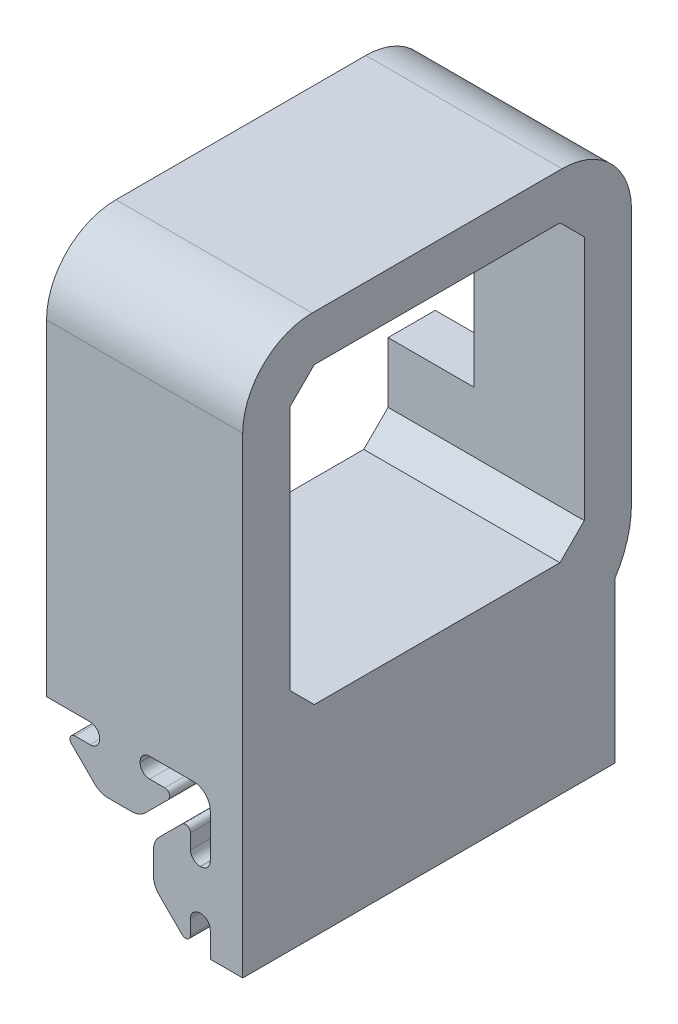
from build123d import *

# Parameters (mm, degrees)
BOSS_EXTRUDE1_DEPTH = 56
SKETCH14_W          = 42.4
SKETCH14_H          = 42.4
CUT_EXTRUDE1_DEPTH  = 56
CHAMFER1_SIZE       = 3.5
FILLET1_R           = 10
SKETCH16_W          = 2.4
SKETCH16_H          = 23
CUT_EXTRUDE3_DEPTH  = 95.009532523
CUT_EXTRUDE4_REACH  = 93.39
SKETCH17_W          = 15.453545708
SKETCH17_H          = 18
FILLET4_R           = 15
CUT_EXTRUDE5_DEPTH  = 92.389771857


with BuildPart() as part:
    # Sketch1 → Boss-Extrude1 (new body)
    with BuildSketch(Plane.XY):
        with BuildLine():
            Line((13.02, -7.9417418), (17.7, -7.9417418))
            Line((17.7, -7.9417418), (17.7, 70.02))
            Line((17.7, 70.02), (-10.566443095, 70.02))
            Line((-10.566443095, 70.02), (-10.566443095, 13.02))
            Line((-10.566443095, 13.02), (-5.317126718, 13.02))
            Line((-5.317126718, 13.02), (-4.287512407, 13.02))
            ThreePointArc((-4.287512407, 13.02), (-3.319474451, 12.619025549), (-2.9185, 11.650987593))
            Line((-2.9185, 11.650987593), (-2.9185, 11.539212407))
            ThreePointArc((-2.9185, 11.539212407), (-3.319474451, 10.571174451), (-4.287512407, 10.1702))
            Line((-4.287512407, 10.1702), (-6.476788598, 10.1702))
            ThreePointArc((-6.476788598, 10.1702), (-7.136510935, 9.729114651), (-6.981020848, 8.950903446))
            Line((-6.981020848, 8.950903446), (-3.672257405, 5.649701928))
            ThreePointArc((-3.672257405, 5.649701928), (-2.746830644, 5.032499411), (-1.655778399, 4.8158))
            Line((-1.655778399, 4.8158), (1.655778399, 4.8158))
            ThreePointArc((1.655778399, 4.8158), (2.746830644, 5.032499411), (3.672257405, 5.649701928))
            Line((3.672257405, 5.649701928), (6.981020848, 8.950903446))
            ThreePointArc((6.981020848, 8.950903446), (7.136510935, 9.729114651), (6.476788598, 10.1702))
            Line((6.476788598, 10.1702), (4.287512407, 10.1702))
            ThreePointArc((4.287512407, 10.1702), (3.319474451, 10.571174451), (2.9185, 11.539212407))
            Line((2.9185, 11.539212407), (2.9185, 11.650987593))
            ThreePointArc((2.9185, 11.650987593), (3.319474451, 12.619025549), (4.287512407, 13.02))
            Line((4.287512407, 13.02), (6.332886163, 13.02))
            Line((6.332886163, 13.02), (10.562594215, 13.019824354))
            ThreePointArc((10.562594215, 13.019824354), (12.303594776, 12.313982883), (13.019956614, 10.577284622))
            Line((13.019956614, 10.577284622), (13.02, 4.287469289))
            ThreePointArc((13.02, 4.287469289), (12.619025549, 3.319431332), (11.650987593, 2.918456882))
            Line((11.650987593, 2.918456882), (11.539212407, 2.918456882))
            ThreePointArc((11.539212407, 2.918456882), (10.571174451, 3.319431332), (10.1702, 4.287469289))
            Line((10.1702, 4.287469289), (10.1702, 6.402089023))
            ThreePointArc((10.1702, 6.402089023), (9.733877283, 7.055496588), (8.963146507, 6.90287605))
            Line((8.963146507, 6.90287605), (5.667020993, 3.614283579))
            ThreePointArc((5.667020993, 3.614283579), (5.046449321, 2.687255303), (4.8285, 1.593185507))
            Line((4.8285, 1.593185507), (4.8285, -1.593185507))
            ThreePointArc((4.8285, -1.593185507), (5.046449321, -2.687255303), (5.667020993, -3.614283579))
            Line((5.667020993, -3.614283579), (8.963146507, -6.90287605))
            ThreePointArc((8.963146507, -6.90287605), (9.733877283, -7.055496588), (10.1702, -6.402089023))
            Line((10.1702, -6.402089023), (10.1702, -4.287469289))
            ThreePointArc((10.1702, -4.287469289), (10.571174451, -3.319431332), (11.539212407, -2.918456882))
            Line((11.539212407, -2.918456882), (11.650987593, -2.918456882))
            ThreePointArc((11.650987593, -2.918456882), (12.619025549, -3.319431332), (13.02, -4.287469289))
            Line((13.02, -4.287469289), (13.02, -5.3170836))
            Line((13.02, -5.3170836), (13.02, -7.9417418))
        make_face()
    extrude(amount=BOSS_EXTRUDE1_DEPTH)

    # Sketch14 → Cut-Extrude1 (cut)
    with BuildSketch(Plane(origin=(17.7, 0, 0), x_dir=(0, 0, -1), z_dir=(1, 0, 0))):
        with Locations((-28, 42.22)):
            Rectangle(SKETCH14_W, SKETCH14_H)
    extrude(amount=-CUT_EXTRUDE1_DEPTH, mode=Mode.SUBTRACT)

    # Chamfer1
    chamfer1_edges = [part.edges().sort_by_distance(p)[0] for p in [
        (3.566778452, 21.02, 49.2),
        (3.566778452, 63.42, 49.2),
        (3.566778452, 63.42, 6.8),
        (3.566778452, 21.02, 6.8),
    ]]
    chamfer(chamfer1_edges, length=CHAMFER1_SIZE)

    # Fillet1
    fillet1_edges = [part.edges().sort_by_distance(p)[0] for p in [
        (3.566778452, 70.02, 56),
        (3.566778452, 70.02, 0),
    ]]
    fillet(fillet1_edges, radius=FILLET1_R)

    # Sketch16 → Cut-Extrude3 (cut, through all)
    with BuildSketch(Plane(origin=(17.7, 0, 0), x_dir=(0, 0, -1), z_dir=(1, 0, 0))):
        with Locations((-54.8, 3.5582582)):
            Rectangle(SKETCH16_W, SKETCH16_H)
    extrude(amount=-CUT_EXTRUDE3_DEPTH, mode=Mode.SUBTRACT)

    # Sketch17 → Cut-Extrude4 (cut, up to next)
    with BuildSketch(Plane.XY.offset(56), mode=Mode.PRIVATE) as cut_extrude4_sk1:
        with Locations((-5.893215949, 42.22)):
            Rectangle(SKETCH17_W, SKETCH17_H)
    cut_extrude4_tool1 = extrude(cut_extrude4_sk1.sketch, amount=-CUT_EXTRUDE4_REACH, mode=Mode.PRIVATE) & part.part
    add(cut_extrude4_tool1.solids().sort_by_distance((-5.893216, 42.22, 56))[0], mode=Mode.SUBTRACT)

    # Fillet4
    # the kernel refuses this fillet: 15 mm, written as the material it takes off along each edge
    with BuildSketch(Plane(origin=(38.046989949, 15.0582582, 56), x_dir=(0, 1, 0), z_dir=(-1, 0, 0))) as fillet4_piece_1:
        with BuildLine():
            CenterArc((8.13879598, 15), FILLET4_R, 237.140119621, 32.859880379)
            Line((0, 2.4), (-0.16277592, 2.148))
            ThreePointArc((-0.16277592, 2.148), (-0.3, 1.2), (-0.3, 0))
            Line((-0.3, 0), (0, -0.3))
            Line((0, -0.3), (8.13879598, -0.3))
            Line((8.13879598, -0.3), (8.13879598, 0))
        make_face()
    extrude(amount=68.960422994, mode=Mode.SUBTRACT)


with BuildPart() as body_2:
    # Mirror2: mirrored copy
    add(part.part.mirror(Plane(origin=(-4.287512407, 11.650987593, 0), x_dir=(1, 0, 0), z_dir=(0, 0, 1))))


with BuildPart() as part_1:
    add(part.part)

    # Sketch18 → Cut-Extrude5 (cut, through all)
    with BuildSketch(Plane(origin=(0, 0, 0), x_dir=(-1, 0, 0), z_dir=(0, 0, -1))):
        Polygon((-23.608513824, 16.914250509), (-37.368077548, 16.914250509), (-37.368077548, -12.201573967), (-23.608513824, -12.201573967), (16.391486176, -12.201573967), (16.391486176, 487.798426033), (-23.608513824, 487.798426033), align=None)
    extrude(amount=-CUT_EXTRUDE5_DEPTH, mode=Mode.SUBTRACT)


solid = body_2.part
